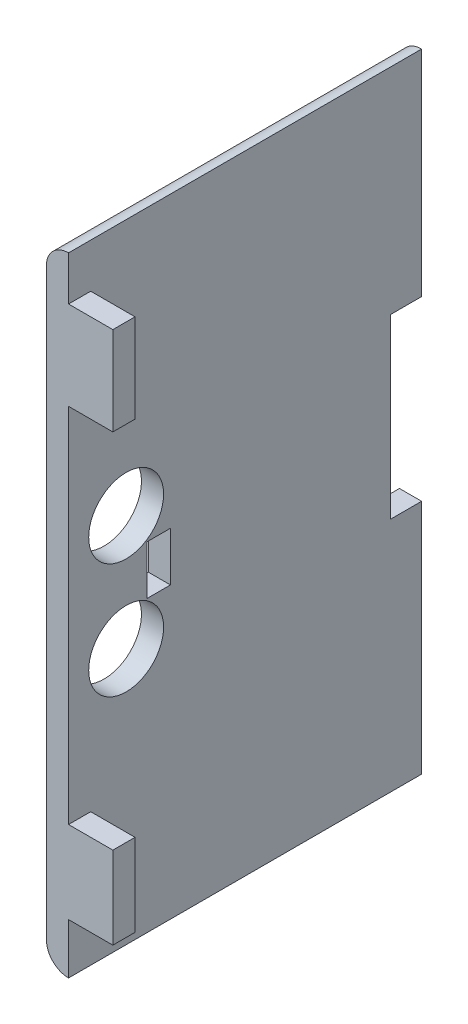
from build123d import *

# Parameters (mm, degrees)
CROQUIS2_W              = 200
CROQUIS2_H              = 150
CROQUIS2_R              = 2
CROQUIS2_R_2            = 2.5
CROQUIS2_W_2            = 31.297292299
CROQUIS2_H_2            = 43.768728426
CROQUIS2_H_3            = 43.768728427
CROQUIS2_W_3            = 23.573907934
CROQUIS2_H_4            = 45.323962431
SALIENTE_EXTRUIR1_DEPTH = 2
REDONDEO1_R             = 10
BOSS_EXTRUDE1_DEPTH     = 25
SKETCH3_W               = 62.040442094
SKETCH3_H               = 5.530821024
BOSS_EXTRUDE2_DEPTH     = 22
SKETCH8_W               = 62.040442094
SKETCH8_H               = 5.530821024
BOSS_EXTRUDE6_DEPTH     = 13
SKETCH2_W               = 200
SKETCH2_H               = 78.124132015
SKETCH2_W_2             = 62.040442094
SKETCH2_H_2             = 5.530821024
BOSS_EXTRUDE3_DEPTH     = 5
SKETCH4_W               = 62.040442094
SKETCH4_H               = 5.530821024
BOSS_EXTRUDE4_DEPTH     = 19
SKETCH5_W               = 7.442573222
SKETCH5_H               = 2.991451355
BOSS_EXTRUDE5_DEPTH     = 21
SKETCH6_R               = 2.5
CUT_EXTRUDE1_DEPTH      = 158.961544101
FILLET1_R               = 10
SKETCH10_W              = 79.68896036
SKETCH10_H              = 141.741238344
BOSS_EXTRUDE7_DEPTH     = 5
SKETCH11_W              = 5
SKETCH11_H              = 20
BOSS_EXTRUDE13_DEPTH    = 15
FILLET2_R               = 5
CUT_EXTRUDE3_DEPTH      = 215.07420719
SKETCH15_W              = 7
SKETCH15_H              = 40
CUT_EXTRUDE5_DEPTH      = 10
CROQUIS4_R              = 8.45
CROQUIS4_W              = 5.32
CROQUIS4_H              = 11.08
CORTAR_EXTRUIR3_DEPTH   = 95


# Read off the part's stored shape, not the designer's step: Cut-Extrude4
# Some blends are built 0.0001 mm under size
with BuildPart() as part:
    # Croquis2 → Saliente-Extruir1 (new body)
    with BuildSketch(Plane.XY):
        with Locations((0.108263467, -0.36008145)):
            Rectangle(CROQUIS2_W, CROQUIS2_H)
        with Locations((89.108263467, -66.5)):
            Circle(CROQUIS2_R, mode=Mode.SUBTRACT)
        with Locations((-88.891736533, -66.5)):
            Circle(CROQUIS2_R, mode=Mode.SUBTRACT)
        with Locations(Location((89.108263467, 65.779837101, 0), (0, 0, 180))):
            Circle(CROQUIS2_R, mode=Mode.SUBTRACT)
        with Locations(Location((-88.891736533, 65.779837101, 0), (0, 0, 180))):
            Circle(CROQUIS2_R, mode=Mode.SUBTRACT)
        with Locations((-80.865436179, -59.36008145)):
            Circle(CROQUIS2_R_2, mode=Mode.SUBTRACT)
        with Locations((81.108263467, -59.36008145)):
            Circle(CROQUIS2_R_2, mode=Mode.SUBTRACT)
        with Locations(Location((81.108263467, 58.63991855, 0), (0, 0, 180))):
            Circle(CROQUIS2_R_2, mode=Mode.SUBTRACT)
        with Locations(Location((-80.865436179, 58.63991855, 0), (0, 0, 180))):
            Circle(CROQUIS2_R_2, mode=Mode.SUBTRACT)
        with BuildLine():
            Line((-62.091736533, 70.63991855), (64.108263467, 70.63991855))
            ThreePointArc((64.108263467, 70.63991855), (66.108263467, 68.63991855), (64.108263467, 66.63991855))
            Line((64.108263467, 66.63991855), (-62.091736533, 66.63991855))
            ThreePointArc((-62.091736533, 66.63991855), (-64.091736533, 68.63991855), (-62.091736533, 70.63991855))
        make_face(mode=Mode.SUBTRACT)
        Polygon((-71.391736533, -12.902447307), (-71.391736533, 12.182284408), (-79.241736533, 12.28991855), (-83.891736533, 12.28991855), (-83.891736533, -13.01008145), (-79.241736533, -13.01008145), align=None, mode=Mode.SUBTRACT)
        with BuildLine():
            Line((92.108263467, 45.478381757), (92.108263467, -46.198544657))
            ThreePointArc((92.108263467, -46.198544657), (90.807295546, -47.897576736), (89.108263467, -46.596608814))
            Line((89.108263467, -46.596608814), (89.108263467, 45.876445915))
            ThreePointArc((89.108263467, 45.876445915), (90.807295546, 47.177413836), (92.108263467, 45.478381757))
        make_face(mode=Mode.SUBTRACT)
        Polygon((84.108263467, 12.28991855), (84.108263467, -13.01008145), (79.458263467, -13.01008145), (71.608263467, -13.01008145), (71.608263467, 12.28991855), (79.458263467, 12.28991855), align=None, mode=Mode.SUBTRACT)
        with BuildLine():
            Line((-91.891736533, 45.478381757), (-91.891736533, -46.198544657))
            ThreePointArc((-91.891736533, -46.198544657), (-90.590768612, -47.897576736), (-88.891736533, -46.596608814))
            Line((-88.891736533, -46.596608814), (-88.891736533, 45.876445915))
            ThreePointArc((-88.891736533, 45.876445915), (-90.590768612, 47.177413836), (-91.891736533, 45.478381757))
        make_face(mode=Mode.SUBTRACT)
        with Locations((-30.011405388, 36.299005811)):
            Rectangle(CROQUIS2_W_2, CROQUIS2_H_2, mode=Mode.SUBTRACT)
        with BuildLine():
            Line((-62.091736533, -71.36008145), (64.108263467, -71.36008145))
            ThreePointArc((64.108263467, -71.36008145), (66.108263467, -69.36008145), (64.108263467, -67.36008145))
            Line((64.108263467, -67.36008145), (-62.091736533, -67.36008145))
            ThreePointArc((-62.091736533, -67.36008145), (-64.091736533, -69.36008145), (-62.091736533, -71.36008145))
        make_face(mode=Mode.SUBTRACT)
        with Locations((-30.011405388, -26.799059535)):
            Rectangle(CROQUIS2_W_2, CROQUIS2_H_3, mode=Mode.SUBTRACT)
        with Locations((12.982877294, -0.693345879)):
            Rectangle(CROQUIS2_W_3, CROQUIS2_H_4, mode=Mode.SUBTRACT)
    extrude(amount=SALIENTE_EXTRUIR1_DEPTH)

    # Redondeo1
    redondeo1_edges = [part.edges().sort_by_distance(p)[0] for p in [
        (100.108263467, -75.36008145, 1),
        (-99.891736533, -75.36008145, 1),
        (-99.891736533, 74.63991855, 1),
        (100.108263467, 74.63991855, 1),
    ]]
    fillet(redondeo1_edges, radius=REDONDEO1_R)

    # Sketch1 → Boss-Extrude1 (add)
    with BuildSketch(Plane.XY.offset(2)):
        Polygon((-67.071845217, 64.63991855), (-67.071845217, 60.63991855), (-8.841198185, 60.63991855), (-8.841198185, 3.63991855), (-67.071845217, 3.63991855), (-67.071845217, -0.36008145), (-8.841198185, -0.36008145), (-8.841198185, -53.36008145), (-67.071845217, -53.36008145), (-67.071845217, -57.574734434), (-5.031403123, -57.574734434), (-5.031403123, -40.931443482), (46.608263467, -40.931443482), (46.608263467, -36.931443482), (-5.031403123, -36.931443482), (-5.031403123, 30.068556518), (46.608263467, 30.068556518), (46.608263467, 34.068556518), (-5.031403123, 34.068556518), (-5.031403123, 64.63991855), align=None)
    extrude(amount=BOSS_EXTRUDE1_DEPTH)

    # Sketch3 → Boss-Extrude2 (add)
    with BuildSketch(Plane.XZ.offset(57.574734434)):
        with Locations((-36.05162417, 24.234589488)):
            Rectangle(SKETCH3_W, SKETCH3_H)
    extrude(amount=BOSS_EXTRUDE2_DEPTH)

    # Sketch8 → Boss-Extrude6 (add)
    with BuildSketch(Plane(origin=(0, 64.63991855, 0), x_dir=(1, 0, 0), z_dir=(0, 1, 0))):
        with Locations((-36.05162417, -24.234589488)):
            Rectangle(SKETCH8_W, SKETCH8_H)
    extrude(amount=BOSS_EXTRUDE6_DEPTH)

    # Sketch2 → Boss-Extrude3 (add)
    with BuildSketch(Plane.XZ.offset(75.36008145)):
        with Locations((0.108263467, 41.062066008)):
            Rectangle(SKETCH2_W, SKETCH2_H)
        with Locations((-36.05162417, 24.234589488)):
            Rectangle(SKETCH2_W_2, SKETCH2_H_2, mode=Mode.SUBTRACT)
    extrude(amount=-BOSS_EXTRUDE3_DEPTH)

    # Sketch4 → Boss-Extrude4 (add)
    with BuildSketch(Plane(origin=(0, 64.63991855, 0), x_dir=(1, 0, 0), z_dir=(0, 1, 0))):
        with Locations((-36.05162417, -24.234589488)):
            Rectangle(SKETCH4_W, SKETCH4_H)
    extrude(amount=BOSS_EXTRUDE4_DEPTH)

    # Sketch5 → Boss-Extrude5 (add)
    with BuildSketch(Plane.XZ.offset(75.36008145)):
        with Locations((-80.540187187, 3.495725678)):
            Rectangle(SKETCH5_W, SKETCH5_H)
        with Locations((80.756714122, 3.495725678)):
            Rectangle(SKETCH5_W, SKETCH5_H)
    extrude(amount=BOSS_EXTRUDE5_DEPTH)

    # Sketch6 → Cut-Extrude1 (cut, through all)
    with BuildSketch(Plane.XY.offset(4.991451355)):
        with Locations((-80.996023003, -59.284349751)):
            Circle(SKETCH6_R)
        with Locations((81.166025964, -59.051385225)):
            Circle(SKETCH6_R)
    extrude(amount=-CUT_EXTRUDE1_DEPTH, mode=Mode.SUBTRACT)

    # Fillet1
    # the kernel refuses this fillet: 10 mm, written as the material it takes off along each edge
    with BuildSketch(Plane(origin=(100.108263467, -70.36008145, 2), x_dir=(-1, 0, 0), z_dir=(0, 0, 1)), Plane(origin=(-99.891736533, -70.36008145, 101.77476711), x_dir=(1, 0, 0), z_dir=(0, 0, -1))) as fillet1_piece_1:
        with BuildLine():
            CenterArc((8.660254038, 10), FILLET1_R, 210, 60)
            Line((0, 5), (0, 0))
            Line((0, 0), (8.660254038, 0))
        make_face()
    extrude(amount=99.77476711, mode=Mode.SUBTRACT)


with BuildPart() as body_2:
    # Sketch10 → Boss-Extrude7 (new body)
    with BuildSketch(Plane.ZY.offset(99.891736533)):
        with Locations((-39.84448018, -2.473210197)):
            Rectangle(SKETCH10_W, SKETCH10_H)
    extrude(amount=BOSS_EXTRUDE7_DEPTH)

    # Sketch11 → Boss-Extrude13 (add)
    with BuildSketch(Plane.ZY.offset(104.891736533)):
        with Locations((-2.5, -53.343829369)):
            Rectangle(SKETCH11_W, SKETCH11_H)
        with Locations((-2.5, 48.397408975)):
            Rectangle(SKETCH11_W, SKETCH11_H)
    extrude(amount=-BOSS_EXTRUDE13_DEPTH)

    # Fillet2
    fillet2_edges = [body_2.edges().sort_by_distance(p)[0] for p in [
        (-104.891736533, 68.397408975, -39.84448018),
        (-104.891736533, -73.343829369, -39.84448018),
    ]]
    fillet(fillet2_edges, radius=FILLET2_R - 0.0001)  # a hair under: the kernel refuses the full size


with BuildPart() as cut_extrude3_tool:
    # Sketch13 → Cut-Extrude3 (new, through all)
    with BuildSketch(Plane.XY.offset(80.124132015)):
        Polygon((-88.891736533, 38.397408975), (-87.891736533, 38.397408975), (-87.891736533, 63.52554782), (-99.891736533, 63.52554782), (-99.891736533, 94.010082764), (108.48763668, 94.010082764), (108.48763668, -102.123784964), (-99.891736533, -102.123784964), (-99.891736533, -61.922986139), (-88.478309969, -61.922986139), (-88.478309969, -40.956005085), (-99.891736533, -40.956005085), (-99.891736533, 38.397408975), align=None)
    extrude(amount=-CUT_EXTRUDE3_DEPTH)


with BuildPart() as part_1:
    add(part.part)

    # Cut-Extrude3: cut by cut_extrude3_tool
    add(cut_extrude3_tool.part, mode=Mode.SUBTRACT)


with BuildPart() as body_2_1:
    add(body_2.part)

    # Cut-Extrude3: cut by cut_extrude3_tool
    add(cut_extrude3_tool.part, mode=Mode.SUBTRACT)

    # Sketch15 → Cut-Extrude5 (cut)
    with BuildSketch(Plane(origin=(-99.891736533, 0, 0), x_dir=(0, 0, -1), z_dir=(1, 0, 0))):
        with Locations((76.18896036, 0)):
            Rectangle(SKETCH15_W, SKETCH15_H)
    extrude(amount=-CUT_EXTRUDE5_DEPTH, mode=Mode.SUBTRACT)

    # Croquis4 → Cortar-Extruir3 (cut)
    with BuildSketch(Plane.ZY.offset(104.891736533)):
        with Locations((-13, 10.526789803)):
            Circle(CROQUIS4_R)
        with Locations((-13, -15.473210197)):
            Circle(CROQUIS4_R)
        with Locations((-20.34, -2.473210197)):
            Rectangle(CROQUIS4_W, CROQUIS4_H)
    extrude(amount=-CORTAR_EXTRUIR3_DEPTH, mode=Mode.SUBTRACT)


solid = body_2_1.part
